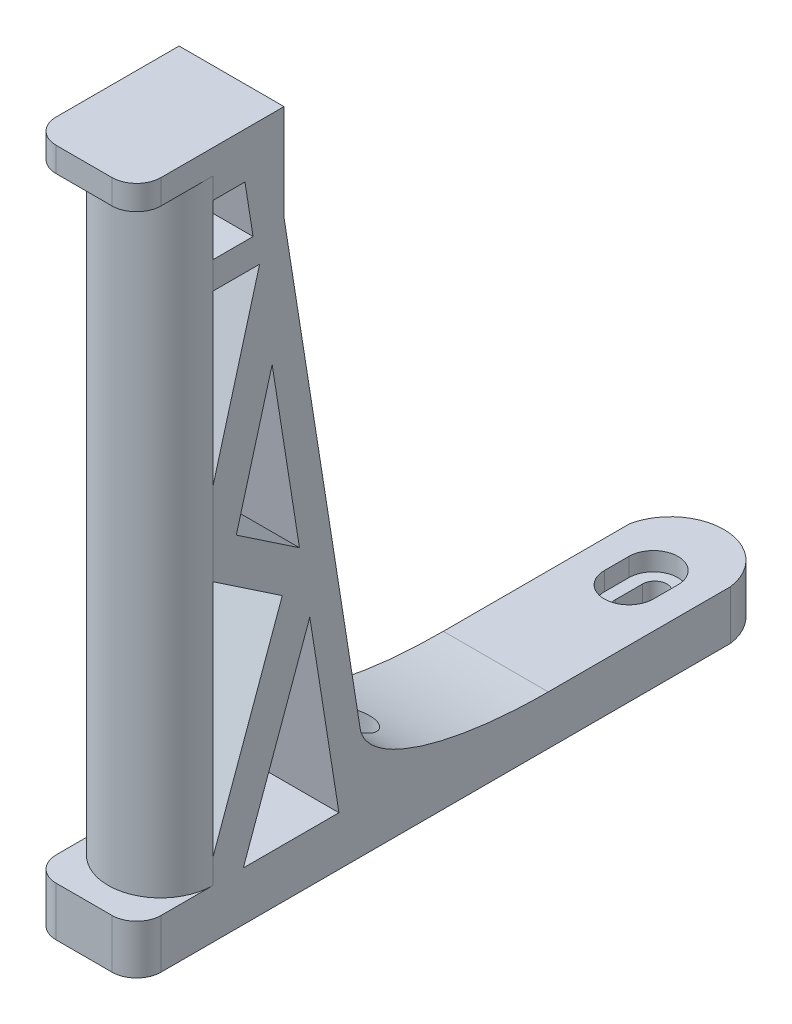
from build123d import *

# Parameters (mm, degrees)
BOSS_EXTRUDE1_DEPTH = 5
BOSS_EXTRUDE2_START = 5
BOSS_EXTRUDE2_DEPTH = 3
BOSS_EXTRUDE3_START = 8
BOSS_EXTRUDE3_DEPTH = 100
CHAMFER1_SIZE       = 14
CHAMFER1_SIZE2      = 88.392521205
CUT_EXTRUDE1_REACH  = 228.845
CUT_EXTRUDE2_REACH  = 243.541
CUT_EXTRUDE3_START  = 5
CUT_EXTRUDE3_DEPTH  = 25.406962
BOSS_EXTRUDE4_DEPTH = 4
BOSS_EXTRUDE5_START = -108
BOSS_EXTRUDE5_DEPTH = 8


with BuildPart() as part:
    # Sketch1 → Boss-Extrude1 (new body)
    # profile 1 of 5: a face of its own
    with BuildSketch(Plane(origin=(0, 0, 0), x_dir=(1, 0, 0), z_dir=(0, 1, 0))):
        with BuildLine():
            Line((-67.63171498, -190.215666308), (-67.63171498, -178.666752182))
            Line((-67.63171498, -178.666752182), (-84.707225068, -178.666752182))
            Line((-84.707225068, -178.666752182), (-84.707225068, -190.215666308))
            ThreePointArc((-84.707225068, -190.215666308), (-76.169470024, -198.753421352), (-67.63171498, -190.215666308))
        make_face()
    # profile 2 of 5: a face of its own
    with BuildSketch(Plane(origin=(0, 0, 0), x_dir=(1, 0, 0), z_dir=(0, 1, 0))):
        with BuildLine():
            Line((-84.707225068, -178.666752182), (-67.63171498, -178.666752182))
            Line((-67.63171498, -178.666752182), (-67.63171498, -106.004837653))
            ThreePointArc((-67.63171498, -106.004837653), (-75.871331662, -98.476802493), (-84.707225068, -105.29512957))
            Line((-84.707225068, -105.29512957), (-84.707225068, -178.666752182))
        make_face()
        with BuildLine():
            ThreePointArc((-80.169470024, -160.215666308), (-76.169470024, -156.215666308), (-72.169470024, -160.215666308))
            Line((-72.169470024, -160.215666308), (-72.169470024, -164.215666308))
            ThreePointArc((-72.169470024, -164.215666308), (-76.169470024, -168.215666308), (-80.169470024, -164.215666308))
            Line((-80.169470024, -164.215666308), (-80.169470024, -160.215666308))
        make_face(mode=Mode.SUBTRACT)
        with BuildLine():
            ThreePointArc((-80.169470024, -110.004837653), (-76.169470024, -106.004837653), (-72.169470024, -110.004837653))
            Line((-72.169470024, -110.004837653), (-72.169470024, -114.004837653))
            ThreePointArc((-72.169470024, -114.004837653), (-76.169470024, -118.004837653), (-80.169470024, -114.004837653))
            Line((-80.169470024, -114.004837653), (-80.169470024, -110.004837653))
        make_face(mode=Mode.SUBTRACT)
    # profile 3 of 5: a face of its own
    with BuildSketch(Plane(origin=(0, 0, 0), x_dir=(1, 0, 0), z_dir=(0, 1, 0))):
        with BuildLine():
            Line((-80.169470024, -160.215666308), (-80.169470024, -164.215666308))
            ThreePointArc((-80.169470024, -164.215666308), (-76.169470024, -168.215666308), (-72.169470024, -164.215666308))
            Line((-72.169470024, -164.215666308), (-72.169470024, -160.215666308))
            ThreePointArc((-72.169470024, -160.215666308), (-76.169470024, -156.215666308), (-80.169470024, -160.215666308))
        make_face()
        with BuildLine():
            ThreePointArc((-74.169470024, -160.294008998), (-76.169470024, -158.294008998), (-78.169470024, -160.294008998))
            Line((-78.169470024, -160.294008998), (-78.169470024, -164.215666308))
            ThreePointArc((-78.169470024, -164.215666308), (-76.169470024, -166.215666308), (-74.169470024, -164.215666308))
            Line((-74.169470024, -164.215666308), (-74.169470024, -160.294008998))
        make_face(mode=Mode.SUBTRACT)
    # profile 4 of 5: a face of its own
    with BuildSketch(Plane(origin=(0, 0, 0), x_dir=(1, 0, 0), z_dir=(0, 1, 0))):
        with BuildLine():
            Line((-80.169470024, -110.004837653), (-80.169470024, -114.004837653))
            ThreePointArc((-80.169470024, -114.004837653), (-76.169470024, -118.004837653), (-72.169470024, -114.004837653))
            Line((-72.169470024, -114.004837653), (-72.169470024, -110.004837653))
            ThreePointArc((-72.169470024, -110.004837653), (-76.169470024, -106.004837653), (-80.169470024, -110.004837653))
        make_face()
        with BuildLine():
            ThreePointArc((-74.169470024, -109.794008998), (-76.169470024, -107.794008998), (-78.169470024, -109.794008998))
            Line((-78.169470024, -109.794008998), (-78.169470024, -114.215666308))
            ThreePointArc((-78.169470024, -114.215666308), (-76.169470024, -116.215666308), (-74.169470024, -114.215666308))
            Line((-74.169470024, -114.215666308), (-74.169470024, -109.794008998))
        make_face(mode=Mode.SUBTRACT)
    # profile 5 of 5: a face of its own
    with BuildSketch(Plane(origin=(0, 0, 0), x_dir=(1, 0, 0), z_dir=(0, 1, 0))):
        with BuildLine():
            Line((-74.169470024, -164.215666308), (-74.169470024, -160.294008998))
            ThreePointArc((-74.169470024, -160.294008998), (-76.169470024, -158.294008998), (-78.169470024, -160.294008998))
            Line((-78.169470024, -160.294008998), (-78.169470024, -164.215666308))
            ThreePointArc((-78.169470024, -164.215666308), (-76.169470024, -166.215666308), (-74.169470024, -164.215666308))
        make_face()
    extrude(amount=BOSS_EXTRUDE1_DEPTH)

    # Sketch1<3> → Boss-Extrude2 (add)
    with BuildSketch(Plane(origin=(0, 0, 0), x_dir=(1, 0, 0), z_dir=(0, 1, 0)).offset(BOSS_EXTRUDE2_START)):
        with BuildLine():
            Line((-67.63171498, -190.215666308), (-67.63171498, -106.004837653))
            ThreePointArc((-67.63171498, -106.004837653), (-75.871331662, -98.476802493), (-84.707225068, -105.29512957))
            Line((-84.707225068, -105.29512957), (-84.707225068, -190.215666308))
            ThreePointArc((-84.707225068, -190.215666308), (-76.169470024, -198.753421352), (-67.63171498, -190.215666308))
        make_face()
        with BuildLine():
            Line((-72.169470024, -110.004837653), (-72.169470024, -114.004837653))
            ThreePointArc((-72.169470024, -114.004837653), (-76.169470024, -118.004837653), (-80.169470024, -114.004837653))
            Line((-80.169470024, -114.004837653), (-80.169470024, -110.004837653))
            ThreePointArc((-80.169470024, -110.004837653), (-76.169470024, -106.004837653), (-72.169470024, -110.004837653))
        make_face(mode=Mode.SUBTRACT)
    extrude(amount=BOSS_EXTRUDE2_DEPTH)

    # Sketch1<4> → Boss-Extrude3 (add)
    with BuildSketch(Plane(origin=(0, 0, 0), x_dir=(1, 0, 0), z_dir=(0, 1, 0)).offset(BOSS_EXTRUDE3_START)):
        with BuildLine():
            Line((-67.63171498, -190.215666308), (-67.63171498, -178.666752182))
            Line((-67.63171498, -178.666752182), (-84.707225068, -178.666752182))
            Line((-84.707225068, -178.666752182), (-84.707225068, -190.215666308))
            ThreePointArc((-84.707225068, -190.215666308), (-76.169470024, -198.753421352), (-67.63171498, -190.215666308))
        make_face()
    extrude(amount=BOSS_EXTRUDE3_DEPTH)

    # Chamfer1
    chamfer1_edges = [part.edges().sort_by_distance(p)[0] for p in [
        (-76.169470024, 8, 178.666752182),
    ]]
    chamfer1_side = [part.faces().sort_by_distance(p)[0] for p in [
        (-76.174011802, 8, 141.227226291),
    ]]
    chamfer(chamfer1_edges, length=CHAMFER1_SIZE, length2=CHAMFER1_SIZE2, reference=chamfer1_side[0])

    # Fillet1
    # an asymmetric fillet: 31, 15 mm, written as the material it adds along each edge
    with BuildSketch(Plane(origin=(-67.63171498, 8, 164.666752182), x_dir=(0, 0.9876883405951381, 0.15643446504022812), z_dir=(-1, 0, 0))) as fillet1_piece_1:
        with BuildLine():
            Bezier((10.277059237, 0), (0, 0), (-4.538265872, 28.653483024), weights=[1, 0.760405966, 1])
            Line((-4.538265872, 28.653483024), (0, 0))
            Line((0, 0), (10.277059237, 0))
        make_face()
    extrude(amount=17.075510088)

    # Sketch2 → Cut-Extrude1 (cut, up to next)
    with BuildSketch(Plane.ZY.offset(84.707225068), mode=Mode.PRIVATE) as cut_extrude1_sk1:
        Polygon((190.215666308, 91.769109668), (182.636112577, 91.769109668), (190.215666308, 64.31043598), align=None)
    cut_extrude1_tool1 = extrude(cut_extrude1_sk1.sketch, amount=-CUT_EXTRUDE1_REACH, mode=Mode.PRIVATE) & part.part
    # Sketch2 → Cut-Extrude1 (cut, up to next)
    with BuildSketch(Plane.ZY.offset(84.707225068), mode=Mode.PRIVATE) as cut_extrude1_sk2:
        Polygon((176.154286922, 48.567173756), (180.595955478, 76.61076533), (186.42899162, 55.479252617), align=None)
    cut_extrude1_tool2 = extrude(cut_extrude1_sk2.sketch, amount=-CUT_EXTRUDE1_REACH, mode=Mode.PRIVATE) & part.part
    # Sketch2 → Cut-Extrude1 (cut, up to next)
    with BuildSketch(Plane.ZY.offset(84.707225068), mode=Mode.PRIVATE) as cut_extrude1_sk3:
        Polygon((190.215666308, 12.025794409), (190.215666308, 50.795315392), (178.946314561, 43.21410987), align=None)
    cut_extrude1_tool3 = extrude(cut_extrude1_sk3.sketch, amount=-CUT_EXTRUDE1_REACH, mode=Mode.PRIVATE) & part.part
    # Sketch2 → Cut-Extrude1 (cut, up to next)
    with BuildSketch(Plane.ZY.offset(84.707225068), mode=Mode.PRIVATE) as cut_extrude1_sk4:
        Polygon((174.47148672, 37.942391428), (185.290645631, 8), (169.729077811, 8), align=None)
    cut_extrude1_tool4 = extrude(cut_extrude1_sk4.sketch, amount=-CUT_EXTRUDE1_REACH, mode=Mode.PRIVATE) & part.part
    # Sketch2 → Cut-Extrude1 (cut, up to next)
    with BuildSketch(Plane.ZY.offset(84.707225068), mode=Mode.PRIVATE) as cut_extrude1_sk5:
        Polygon((185.02175896, 104.554188767), (183.698567215, 96.199884882), (190.215666308, 96.199884882), (190.215666308, 104.554188767), align=None)
    cut_extrude1_tool5 = extrude(cut_extrude1_sk5.sketch, amount=-CUT_EXTRUDE1_REACH, mode=Mode.PRIVATE) & part.part
    add(cut_extrude1_tool1.solids().sort_by_distance((-84.707225, 82.616218, 187.689148))[0], mode=Mode.SUBTRACT)
    add(cut_extrude1_tool2.solids().sort_by_distance((-84.707225, 60.219064, 181.059745))[0], mode=Mode.SUBTRACT)
    add(cut_extrude1_tool3.solids().sort_by_distance((-84.707225, 35.345073, 186.459216))[0], mode=Mode.SUBTRACT)
    add(cut_extrude1_tool4.solids().sort_by_distance((-84.707225, 17.980797, 176.49707))[0], mode=Mode.SUBTRACT)
    add(cut_extrude1_tool5.solids().sort_by_distance((-84.707225, 100.219716, 187.275456))[0], mode=Mode.SUBTRACT)

    # Sketch1<5> → Cut-Extrude2 (cut, up to next)
    with BuildSketch(Plane(origin=(0, 0, 0), x_dir=(1, 0, 0), z_dir=(0, 1, 0)), mode=Mode.PRIVATE) as cut_extrude2_sk1:
        with BuildLine():
            Line((-74.169470024, -164.215666308), (-74.169470024, -160.294008998))
            ThreePointArc((-74.169470024, -160.294008998), (-76.169470024, -158.294008998), (-78.169470024, -160.294008998))
            Line((-78.169470024, -160.294008998), (-78.169470024, -164.215666308))
            ThreePointArc((-78.169470024, -164.215666308), (-76.169470024, -166.215666308), (-74.169470024, -164.215666308))
        make_face()
    cut_extrude2_tool1 = extrude(cut_extrude2_sk1.sketch, amount=CUT_EXTRUDE2_REACH, mode=Mode.PRIVATE) & part.part
    add(cut_extrude2_tool1.solids().sort_by_distance((-76.16947, 0, 162.254838))[0], mode=Mode.SUBTRACT)

    # Sketch1<6> → Cut-Extrude3 (cut)
    with BuildSketch(Plane(origin=(0, 0, 0), x_dir=(1, 0, 0), z_dir=(0, 1, 0)).offset(CUT_EXTRUDE3_START)):
        with BuildLine():
            Line((-80.169470024, -160.215666308), (-80.169470024, -164.215666308))
            ThreePointArc((-80.169470024, -164.215666308), (-76.169470024, -168.215666308), (-72.169470024, -164.215666308))
            Line((-72.169470024, -164.215666308), (-72.169470024, -160.215666308))
            ThreePointArc((-72.169470024, -160.215666308), (-76.169470024, -156.215666308), (-80.169470024, -160.215666308))
        make_face()
        with BuildLine():
            ThreePointArc((-74.169470024, -160.294008998), (-76.169470024, -158.294008998), (-78.169470024, -160.294008998))
            Line((-78.169470024, -160.294008998), (-78.169470024, -164.215666308))
            ThreePointArc((-78.169470024, -164.215666308), (-76.169470024, -166.215666308), (-74.169470024, -164.215666308))
            Line((-74.169470024, -164.215666308), (-74.169470024, -160.294008998))
        make_face(mode=Mode.SUBTRACT)
    extrude(amount=CUT_EXTRUDE3_DEPTH, mode=Mode.SUBTRACT)

    # Sketch4 → Boss-Extrude4 (add)
    with BuildSketch(Plane(origin=(0, 108, 0), x_dir=(1, 0, 0), z_dir=(0, 1, 0))):
        with BuildLine():
            Line((-67.63171498, -178.666752182), (-67.63171498, -198.666752182))
            ThreePointArc((-67.63171498, -198.666752182), (-68.803287856, -201.495179307), (-71.63171498, -202.666752182))
            Line((-71.63171498, -202.666752182), (-80.707225068, -202.666752182))
            ThreePointArc((-80.707225068, -202.666752182), (-83.535652193, -201.495179307), (-84.707225068, -198.666752182))
            Line((-84.707225068, -198.666752182), (-84.707225068, -178.666752182))
            Line((-84.707225068, -178.666752182), (-67.63171498, -178.666752182))
        make_face()
    extrude(amount=BOSS_EXTRUDE4_DEPTH)

    # Sketch4<2> → Boss-Extrude5 (add)
    with BuildSketch(Plane(origin=(0, 108, 0), x_dir=(1, 0, 0), z_dir=(0, 1, 0)).offset(BOSS_EXTRUDE5_START)):
        with BuildLine():
            Line((-67.63171498, -178.666752182), (-67.63171498, -198.666752182))
            ThreePointArc((-67.63171498, -198.666752182), (-68.803287856, -201.495179307), (-71.63171498, -202.666752182))
            Line((-71.63171498, -202.666752182), (-80.707225068, -202.666752182))
            ThreePointArc((-80.707225068, -202.666752182), (-83.535652193, -201.495179307), (-84.707225068, -198.666752182))
            Line((-84.707225068, -198.666752182), (-84.707225068, -178.666752182))
            Line((-84.707225068, -178.666752182), (-67.63171498, -178.666752182))
        make_face()
    extrude(amount=BOSS_EXTRUDE5_DEPTH)


solid = part.part
